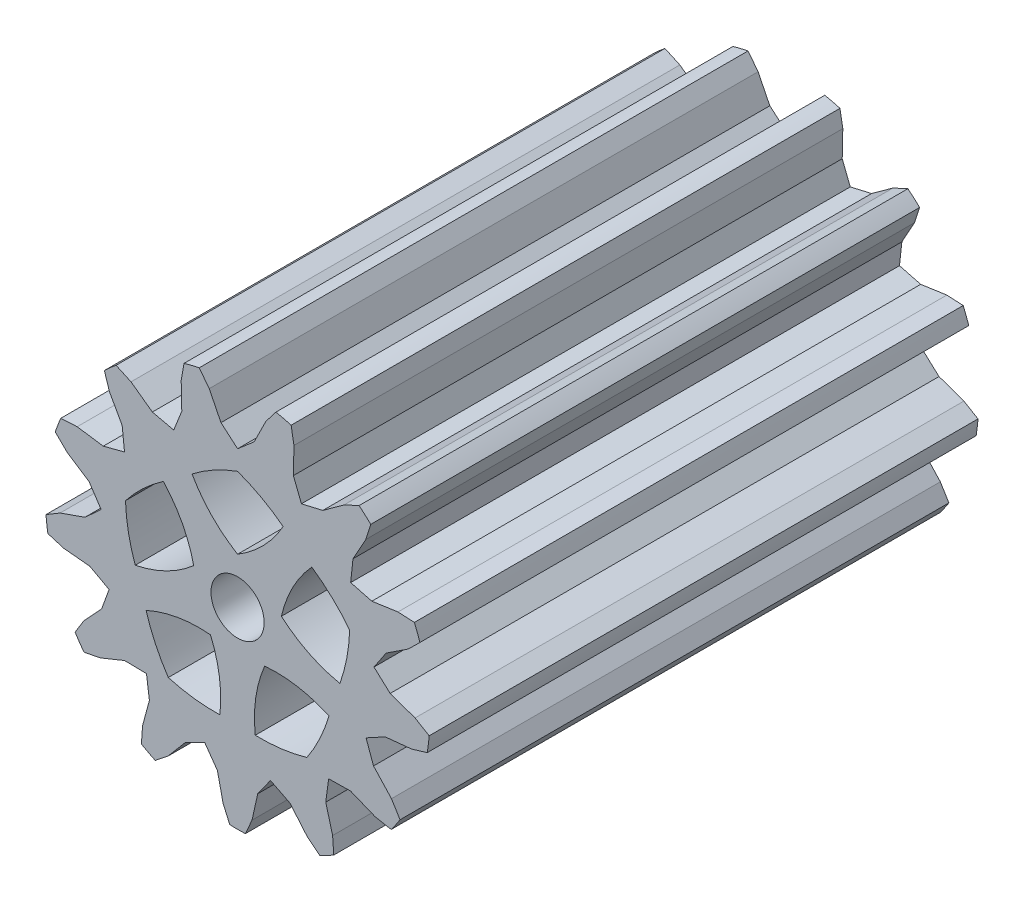
from build123d import *

# Parameters (mm, degrees)
SKETCH1_R               = 11.55555
BOSS_EXTRUDE1_DEPTH     = 33
CUT_EXTRUDE1_DEPTH      = 37.824739939
CUT_EXTRUDE2_DEPTH      = 37.824739939
CUT_EXTRUDE2_DEPTH_BACK = 37.824739939
SKETCH4_R               = 1.6
CIRPATTERN1_COUNT       = 13
CUT_EXTRUDE4_DEPTH      = 37.81312186
CIRPATTERN2_COUNT       = 5


with BuildPart() as part:
    # Sketch1 → Boss-Extrude1 (new body)
    with BuildSketch(Plane.XY):
        Circle(SKETCH1_R)
    extrude(amount=BOSS_EXTRUDE1_DEPTH)

    # Sketch2 → Cut-Extrude1 (cut, through all)
    with BuildSketch(Plane.XY):
        Polygon((0, 8.261391958), (-0.998470792, 9.120819346), (-1.704297747, 10.541884283), (-2.306603416, 11.322999447), (-1.704297747, 12.106198965), (0, 12.820438485), (1.704297747, 12.106198965), (2.306603416, 11.322999447), (1.704297747, 10.541884283), (0.998470792, 9.120819346), align=None)
    cut_extrude1 = extrude(amount=CUT_EXTRUDE1_DEPTH, mode=Mode.SUBTRACT)

    # Sketch4 → Cut-Extrude2 (cut, two sides: drawn at the far end of the back side and taken through both)
    with BuildSketch(Plane.XY.offset(33).offset(-CUT_EXTRUDE2_DEPTH_BACK)):
        Circle(SKETCH4_R)
    extrude(amount=CUT_EXTRUDE2_DEPTH + CUT_EXTRUDE2_DEPTH_BACK, mode=Mode.SUBTRACT)

    # CirPattern1: Cut-Extrude1 ×13 about axis
    cirpattern1_axis = Axis((0, 0, 33), (0, 0, -1))
    for i in range(1, CIRPATTERN1_COUNT):
        add(cut_extrude1.rotate(cirpattern1_axis, i * 360 / CIRPATTERN1_COUNT), mode=Mode.SUBTRACT)

    # Sketch5 → Cut-Extrude4 (cut, symmetric)
    with BuildSketch(Plane.XY):
        with BuildLine():
            ThreePointArc((0, 2.770254471), (-1.552695382, 3.996833454), (-2.739483097, 5.580150817))
            ThreePointArc((-2.739483097, 5.580150817), (-1.427848137, 6.438719488), (0, 7.085848631))
            ThreePointArc((0, 7.085848631), (1.427848137, 6.438719488), (2.739483097, 5.580150817))
            ThreePointArc((2.739483097, 5.580150817), (1.552695382, 3.996833454), (0, 2.770254471))
        make_face()
    cut_extrude4 = extrude(amount=CUT_EXTRUDE4_DEPTH, both=True, mode=Mode.SUBTRACT)

    # CirPattern2: Cut-Extrude4 ×5 about axis
    cirpattern2_axis = Axis((0, 0, 0), (0, 0, 1))
    for i in range(1, CIRPATTERN2_COUNT):
        add(cut_extrude4.rotate(cirpattern2_axis, i * 360 / CIRPATTERN2_COUNT), mode=Mode.SUBTRACT)


solid = part.part
